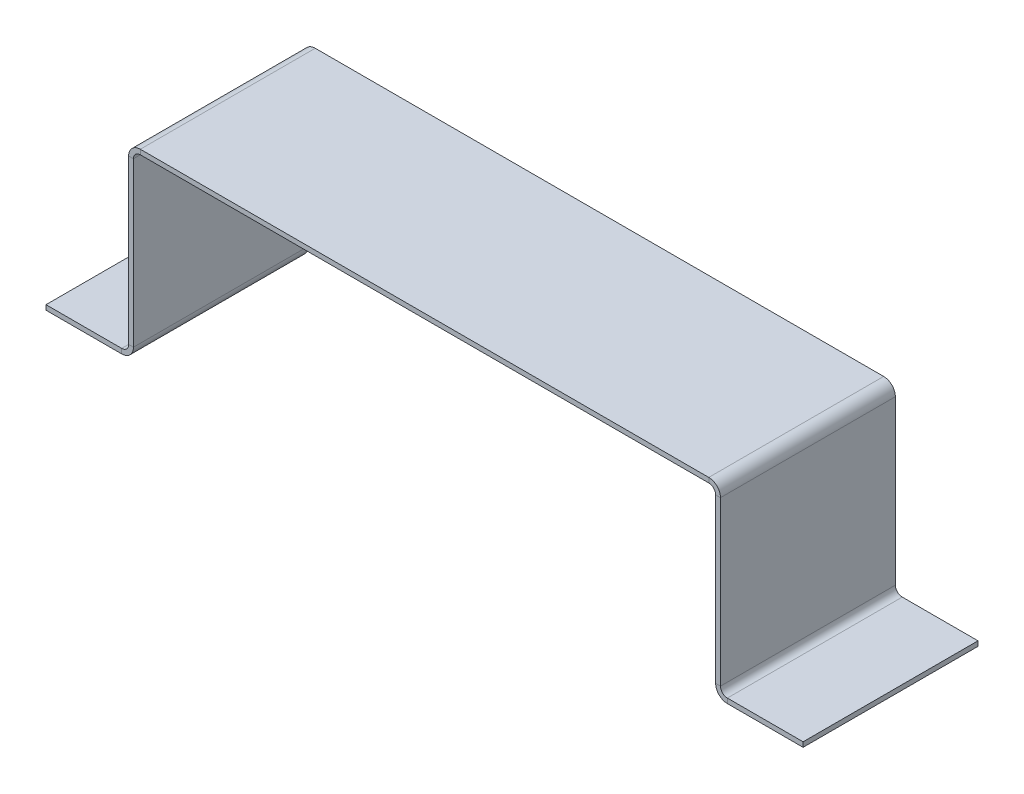
from build123d import *

# Parameters (mm, degrees)
SKETCH1_W          = 82.55
SKETCH1_H          = 25.4
BASE_FLANGE1_DEPTH = 0.7
EDGE_FLANGE1_DEPTH = 25.4
EDGE_FLANGE2_DEPTH = 25.4
EDGE_FLANGE3_DEPTH = 25.4
EDGE_FLANGE4_DEPTH = 25.4


# Sheet-metal steps are written as plain solids
with BuildPart() as part:
    # Sketch1 → Base-Flange1 (new body)
    with BuildSketch(Plane(origin=(0, 0, 0), x_dir=(1, 0, 0), z_dir=(0, 1, 0))):
        Rectangle(SKETCH1_W, SKETCH1_H)
    extrude(amount=-BASE_FLANGE1_DEPTH)

    # Edge-Flange1 section (across the edge) → Edge-Flange1 (add)
    with BuildSketch(Plane(origin=(42.275, -0.7, -12.7), x_dir=(-1, 0, 0), z_dir=(0, 0, 1))):
        with BuildLine():
            Line((-0.7, 1), (-0.7, 24.7))
            Line((-0.7, 24.7), (0, 24.7))
            Line((0, 24.7), (0, 1))
            ThreePointArc((0, 1), (0.292893219, 0.292893219), (1, 0))
            Line((1, 0), (1, -0.7))
            ThreePointArc((1, -0.7), (-0.202081528, -0.202081528), (-0.7, 1))
        make_face()
    extrude(amount=EDGE_FLANGE1_DEPTH)

    # Edge-Flange2 section (across the edge) → Edge-Flange2 (add)
    with BuildSketch(Plane(origin=(42.975, -26.4, 12.7), x_dir=(0, 1, 0), z_dir=(0, 0, -1))):
        with BuildLine():
            Line((-0.7, 1), (-0.7, 12))
            Line((-0.7, 12), (0, 12))
            Line((0, 12), (0, 1))
            ThreePointArc((0, 1), (0.292893219, 0.292893219), (1, 0))
            Line((1, 0), (1, -0.7))
            ThreePointArc((1, -0.7), (-0.202081528, -0.202081528), (-0.7, 1))
        make_face()
    extrude(amount=EDGE_FLANGE2_DEPTH)

    # Edge-Flange3 section (across the edge) → Edge-Flange3 (add)
    with BuildSketch(Plane(origin=(-42.275, -0.7, 12.7), x_dir=(1, 0, 0), z_dir=(0, 0, -1))):
        with BuildLine():
            Line((-0.7, 1), (-0.7, 24.7))
            Line((-0.7, 24.7), (0, 24.7))
            Line((0, 24.7), (0, 1))
            ThreePointArc((0, 1), (0.292893219, 0.292893219), (1, 0))
            Line((1, 0), (1, -0.7))
            ThreePointArc((1, -0.7), (-0.202081528, -0.202081528), (-0.7, 1))
        make_face()
    extrude(amount=EDGE_FLANGE3_DEPTH)

    # Edge-Flange4 section (across the edge) → Edge-Flange4 (add)
    with BuildSketch(Plane(origin=(-42.975, -26.4, -12.7), x_dir=(0, 1, 0), z_dir=(0, 0, 1))):
        with BuildLine():
            Line((-0.7, 1), (-0.7, 12))
            Line((-0.7, 12), (0, 12))
            Line((0, 12), (0, 1))
            ThreePointArc((0, 1), (0.292893219, 0.292893219), (1, 0))
            Line((1, 0), (1, -0.7))
            ThreePointArc((1, -0.7), (-0.202081528, -0.202081528), (-0.7, 1))
        make_face()
    extrude(amount=EDGE_FLANGE4_DEPTH)


solid = part.part
